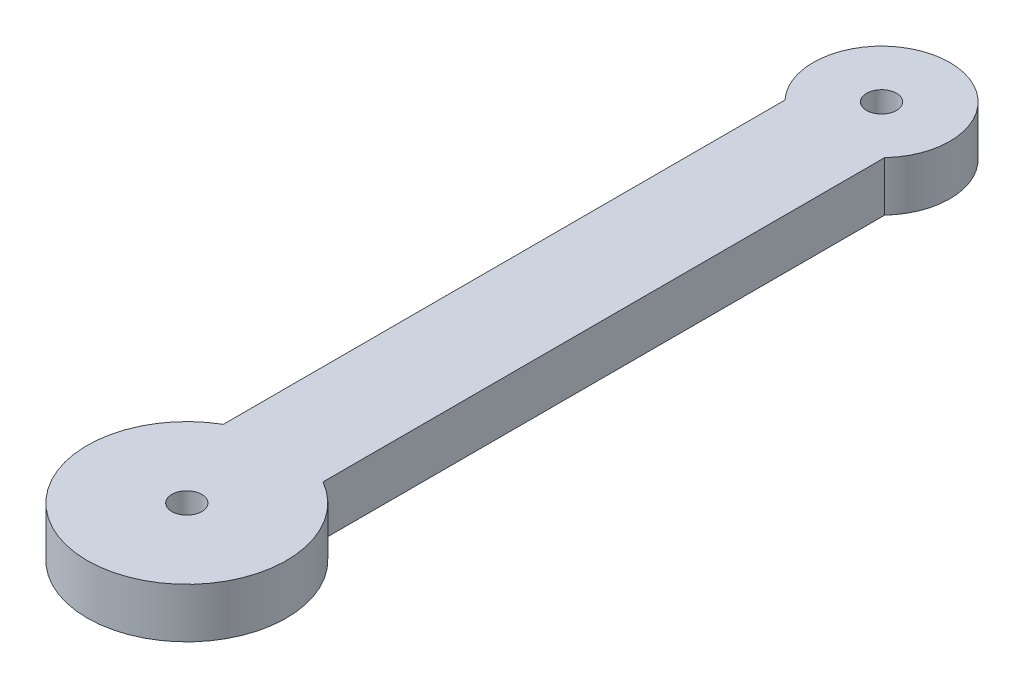
from build123d import *

# Parameters (mm, degrees)
SKETCH2_R           = 0.75
BOSS_EXTRUDE1_DEPTH = 2.5


with BuildPart() as part:
    # Sketch2 → Boss-Extrude1 (new body)
    with BuildSketch(Plane(origin=(0, 0, 0), x_dir=(1, 0, 0), z_dir=(0, 1, 0))):
        with BuildLine():
            Line((-2.5, 32.5), (-2.5, 4.330127019))
            ThreePointArc((-2.5, 4.330127019), (0, -5), (2.5, 4.330127019))
            Line((2.5, 4.330127019), (2.5, 32.5))
            ThreePointArc((2.5, 32.5), (0, 38.268904363), (-2.5, 32.5))
        make_face()
        Circle(SKETCH2_R, mode=Mode.SUBTRACT)
        with Locations((0, 34.842754867)):
            Circle(SKETCH2_R, mode=Mode.SUBTRACT)
    extrude(amount=BOSS_EXTRUDE1_DEPTH)


solid = part.part
